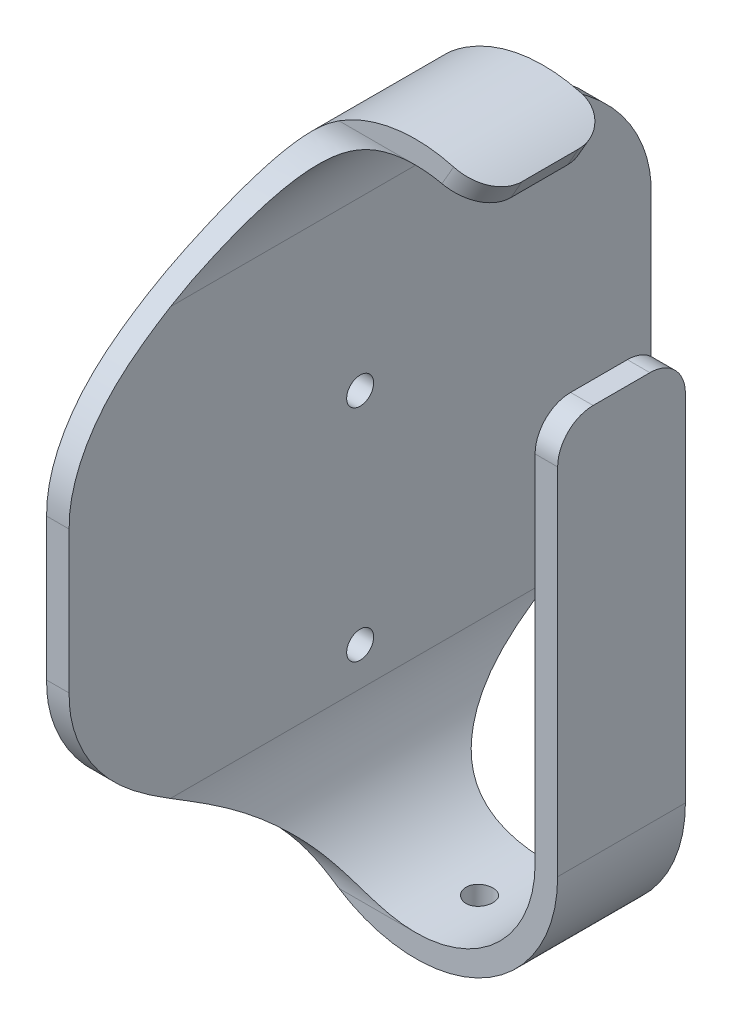
from build123d import *

# Parameters (mm, degrees)
HAND_BAND_BODY_DEPTH      = 41
HAND_BAND_BODY_DEPTH_BACK = 41
BACK_HAND_BRACE_DEPTH     = 93.092344959
PALM_BAND_OUTLINE_W       = 32
PALM_BAND_OUTLINE_H       = 100
PALM_BAND_DEPTH           = 20
SKETCH3_R                 = 1.89865
F_6_BOTTOM_HOLE_DEPTH     = 10
SKETCH4_R                 = 1.89865
F_6_SIDE_HOLES_DEPTH      = 20
FILLET1_R                 = 5


# Read off the part's stored shape, not the designer's step: Palm Band
with BuildPart() as part:
    # Sketch1 → Hand Band Body (new, two sides: drawn at the far end of the back side and taken through both)
    with BuildSketch(Plane.XY.offset(-HAND_BAND_BODY_DEPTH_BACK)):
        with BuildLine():
            Line((-20, 0), (-20, 60))
            ThreePointArc((-20, 60), (-10, 77.320508076), (10, 77.320508076))
            Line((10, 77.320508076), (8.4125, 74.570877419))
            ThreePointArc((8.4125, 74.570877419), (-8.4125, 74.570877419), (-16.825, 60))
            Line((-16.825, 60), (-16.825, 0))
            ThreePointArc((-16.825, 0), (0, -16.825), (16.825, 0))
            Line((16.825, 0), (16.825, 55))
            Line((16.825, 55), (20, 55))
            Line((20, 55), (20, 0))
            ThreePointArc((20, 0), (0, -20), (-20, 0))
        make_face()
    extrude(amount=HAND_BAND_BODY_DEPTH + HAND_BAND_BODY_DEPTH_BACK)

    # Sketch2 → Back-Hand Brace (cut, through all)
    with BuildSketch(Plane(origin=(0, 0, 0), x_dir=(0, 0, -1), z_dir=(1, 0, 0))):
        with BuildLine():
            Line((41, 80), (9, 80))
            Line((9, 80), (9, 76.825))
            add(Edge.make_bspline(
                [(9, 76.825), (9, 76.683054398), (9, 73.844142348), (17.85340715, 63.039379279), (34.522211451, 58.42224391), (41, 44.67531916), (41, 40.222634246), (41, 40)],
                knots=[0, 0, 0, 0, 0.008269556, 0.165391112, 0.746027462, 0.987301373, 1, 1, 1, 1], degree=3))
            Line((41, 40), (41, 80))
        make_face()
        with BuildLine():
            Line((41, -20), (41, 20))
            add(Edge.make_bspline(
                [(9, -16.825), (9, -16.683054398), (9, -13.844142348), (17.85340715, -3.039379279), (34.522211451, 1.57775609), (41, 15.32468084), (41, 19.777365754), (41, 20)],
                knots=[0, 0, 0, 0, 0.008269556, 0.165391112, 0.746027462, 0.987301373, 1, 1, 1, 1], degree=3))
            Line((9, -16.825), (9, -20))
            Line((9, -20), (41, -20))
        make_face()
        with BuildLine():
            Line((-41, 80), (-41, 40))
            add(Edge.make_bspline(
                [(-41, 40), (-41, 40.223460634), (-41, 44.692673321), (-34.522211451, 58.40583885), (-17.85340715, 63.020392952), (-9, 73.856007673), (-9, 76.683619413), (-9, 76.825)],
                knots=[0, 0, 0, 0, 0.012698627, 0.253972538, 0.834608888, 0.991730444, 1, 1, 1, 1], degree=3))
            Line((-9, 76.825), (-9, 80))
            Line((-9, 80), (-41, 80))
        make_face()
        with BuildLine():
            add(Edge.make_bspline(
                [(-9, -16.825), (-9, -16.683054398), (-9, -13.844142348), (-17.85340715, -3.039379279), (-34.522211451, 1.57775609), (-41, 15.32468084), (-41, 19.777365754), (-41, 20)],
                knots=[0, 0, 0, 0, 0.008269556, 0.165391112, 0.746027462, 0.987301373, 1, 1, 1, 1], degree=3))
            Line((-41, 20), (-41, -20))
            Line((-41, -20), (-9, -20))
            Line((-9, -20), (-9, -16.825))
        make_face()
    extrude(amount=-BACK_HAND_BRACE_DEPTH, mode=Mode.SUBTRACT)

    # Palm Band outline → Palm Band (cut)
    with BuildSketch(Plane(origin=(0, 0, 0), x_dir=(0, 0, -1), z_dir=(1, 0, 0))):
        with Locations((-25, 30)):
            Rectangle(PALM_BAND_OUTLINE_W, PALM_BAND_OUTLINE_H)
        with Locations((25, 30)):
            Rectangle(PALM_BAND_OUTLINE_W, PALM_BAND_OUTLINE_H)
    extrude(amount=PALM_BAND_DEPTH, mode=Mode.SUBTRACT)

    # Sketch3 → #6 Bottom Hole (cut)
    with BuildSketch(Plane(origin=(0, -25, 0), x_dir=(-1, 0, 0), z_dir=(0, 1, 0))):
        with Locations(Location((0, 0, 0), (0, 0, 270))):
            Circle(SKETCH3_R)
    extrude(amount=F_6_BOTTOM_HOLE_DEPTH, mode=Mode.SUBTRACT)

    # Sketch4 → #6 Side Holes (cut)
    with BuildSketch(Plane(origin=(-25, 0, 0), x_dir=(0, 0, -1), z_dir=(1, 0, 0))):
        with Locations(Location((0, 36.4, 0), (0, 0, 180))):
            Circle(SKETCH4_R)
        with Locations(Location((0, 5.4, 0), (0, 0, 180))):
            Circle(SKETCH4_R)
    extrude(amount=F_6_SIDE_HOLES_DEPTH, mode=Mode.SUBTRACT)

    # Fillet1
    fillet1_edges = [part.edges().sort_by_distance(p)[0] for p in [
        (18.4125, 55, -9),
        (9.20625, 75.945692747, -9),
        (9.20625, 75.945692747, 9),
        (18.4125, 55, 9),
    ]]
    fillet(fillet1_edges, radius=FILLET1_R)


solid = part.part
